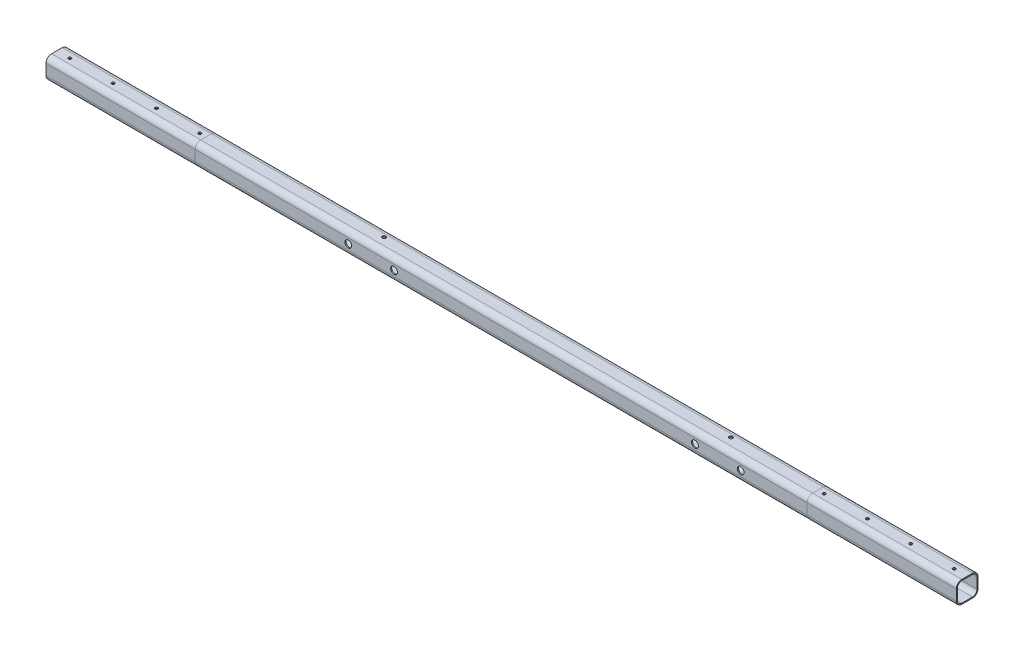
from build123d import *

# Parameters (mm, degrees)
MIEMBRO_ESTRUCTURAL1_DEPTH             = 1412
TALADRO_DE_MARGEN_PARA_M61_D           = 6.6
TALADRO_DE_MARGEN_PARA_M61_DEPTH       = 2.5
MIEMBRO_ESTRUCTURAL2_DEPTH             = 344.4
MIEMBRO_ESTRUCTURAL2_2_DEPTH           = 344.4
CROQUIS7_W                             = 3.3782
CROQUIS7_H                             = 2.5
TALADRO_DE_MARGEN_PARA_1_41_AT_2_COUNT = 2
TALADRO_DE_MARGEN_PARA_1_41_AT_2_PITCH = 45
TALADRO_DE_MARGEN_PARA_1_41_AT_3_COUNT = 2
TALADRO_DE_MARGEN_PARA_1_41_AT_3_PITCH = 90
TALADRO_START                          = 22.5
TALADRO_DE_MARGEN_PARA_1_42_OUTLINE_R  = 3.3782
TALADRO_DE_MARGEN_PARA_1_42_DEPTH      = 2.5
CUT_EXTRUDE1_REACH                     = 1136.143
SKETCH12_R                             = 7.9375
CUT_EXTRUDE2_REACH                     = 1136.143
SKETCH15_R                             = 4.1671875


# Read off the part's stored shape, not the designer's step: Taladro de margen para 1/42
with BuildPart() as part:
    # Sketch1 → Miembro estructural1 (new body)
    with BuildSketch(Plane.YZ.offset(-623.635182539)):
        with BuildLine():
            Line((-12.3, -25), (12.3, -25))
            ThreePointArc((12.3, -25), (21.280256121, -21.280256121), (25, -12.3))
            Line((25, -12.3), (25, 12.3))
            ThreePointArc((25, 12.3), (21.280256121, 21.280256121), (12.3, 25))
            Line((12.3, 25), (-12.3, 25))
            ThreePointArc((-12.3, 25), (-21.280256121, 21.280256121), (-25, 12.3))
            Line((-25, 12.3), (-25, -12.3))
            ThreePointArc((-25, -12.3), (-21.280256121, -21.280256121), (-12.3, -25))
        make_face()
        with BuildLine():
            Line((-12.3, -22.5), (12.3, -22.5))
            ThreePointArc((12.3, -22.5), (19.512489168, -19.512489168), (22.5, -12.3))
            Line((22.5, -12.3), (22.5, 12.3))
            ThreePointArc((22.5, 12.3), (19.512489168, 19.512489168), (12.3, 22.5))
            Line((12.3, 22.5), (-12.3, 22.5))
            ThreePointArc((-12.3, 22.5), (-19.512489168, 19.512489168), (-22.5, 12.3))
            Line((-22.5, 12.3), (-22.5, -12.3))
            ThreePointArc((-22.5, -12.3), (-19.512489168, -19.512489168), (-12.3, -22.5))
        make_face(mode=Mode.SUBTRACT)
    extrude(amount=MIEMBRO_ESTRUCTURAL1_DEPTH)

    # Taladro de margen para M61
    with Locations(Plane(origin=(0, -25, 0), x_dir=(-1, 0, 0), z_dir=(0, -1, 0))):
        with Locations((-152.364817461, 0), (-212.364817461, 0)):
            Hole(TALADRO_DE_MARGEN_PARA_M61_D / 2, depth=TALADRO_DE_MARGEN_PARA_M61_DEPTH)

    # Croquis7 → Taladro de margen para 1/41 (revolve, cut)
    with BuildSketch(Plane(origin=(137.364817461, -25, 0), x_dir=(0, 0, -1), z_dir=(1, 0, 0))):
        with Locations((1.6891, 1.25)):
            Rectangle(CROQUIS7_W, CROQUIS7_H)
    taladro_de_margen_para_1_41 = revolve(axis=Axis((137.364817461, -31.35, 0), (0, 1, 0)), mode=Mode.SUBTRACT)

    # Taladro de margen para 1/41 at 2: Taladro de margen para 1/41 ×2
    with Locations(*[(i * TALADRO_DE_MARGEN_PARA_1_41_AT_2_PITCH, 0, 0) for i in range(1, TALADRO_DE_MARGEN_PARA_1_41_AT_2_COUNT)]):
        add(taladro_de_margen_para_1_41, mode=Mode.SUBTRACT)

    # Taladro de margen para 1/41 at 3: Taladro de margen para 1/41 ×2
    with Locations(*[(i * TALADRO_DE_MARGEN_PARA_1_41_AT_3_PITCH, 0, 0) for i in range(1, TALADRO_DE_MARGEN_PARA_1_41_AT_3_COUNT)]):
        add(taladro_de_margen_para_1_41, mode=Mode.SUBTRACT)

    # Cut-Extrude1: up to this face of the body (flat: up to its plane)
    cut_extrude1_end = Plane(part.part.faces().sort_by_distance((82.364817461, 0, -25))[0])
    # Sketch12 → Cut-Extrude1 (cut, up to the picked face)
    with BuildSketch(Plane.XY.offset(25), mode=Mode.PRIVATE) as cut_extrude1_sk1:
        with Locations((-270.418972539, 0)):
            Circle(SKETCH12_R)
    cut_extrude1_tool1 = split(extrude(cut_extrude1_sk1.sketch, amount=-CUT_EXTRUDE1_REACH, mode=Mode.PRIVATE), bisect_by=cut_extrude1_end, keep=Keep.BOTH, mode=Mode.PRIVATE)
    # Sketch12 → Cut-Extrude1 (cut, up to the picked face)
    with BuildSketch(Plane.XY.offset(25), mode=Mode.PRIVATE) as cut_extrude1_sk2:
        with Locations((635.148607461, 0)):
            Circle(SKETCH12_R)
    cut_extrude1_tool2 = split(extrude(cut_extrude1_sk2.sketch, amount=-CUT_EXTRUDE1_REACH, mode=Mode.PRIVATE), bisect_by=cut_extrude1_end, keep=Keep.BOTH, mode=Mode.PRIVATE)
    # Sketch12 → Cut-Extrude1 (cut, up to the picked face)
    with BuildSketch(Plane.XY.offset(25), mode=Mode.PRIVATE) as cut_extrude1_sk3:
        with Locations((529.581027461, 0)):
            Circle(SKETCH12_R)
    cut_extrude1_tool3 = split(extrude(cut_extrude1_sk3.sketch, amount=-CUT_EXTRUDE1_REACH, mode=Mode.PRIVATE), bisect_by=cut_extrude1_end, keep=Keep.BOTH, mode=Mode.PRIVATE)
    # Sketch12 → Cut-Extrude1 (cut, up to the picked face)
    with BuildSketch(Plane.XY.offset(25), mode=Mode.PRIVATE) as cut_extrude1_sk4:
        with Locations((-164.851392539, 0)):
            Circle(SKETCH12_R)
    cut_extrude1_tool4 = split(extrude(cut_extrude1_sk4.sketch, amount=-CUT_EXTRUDE1_REACH, mode=Mode.PRIVATE), bisect_by=cut_extrude1_end, keep=Keep.BOTH, mode=Mode.PRIVATE)
    add(cut_extrude1_tool1.solids().sort_by(Axis((-270.418973, 0, 25), (0, 0, -1)))[0], mode=Mode.SUBTRACT)
    add(cut_extrude1_tool2.solids().sort_by(Axis((635.148607, 0, 25), (0, 0, -1)))[0], mode=Mode.SUBTRACT)
    add(cut_extrude1_tool3.solids().sort_by(Axis((529.581027, 0, 25), (0, 0, -1)))[0], mode=Mode.SUBTRACT)
    add(cut_extrude1_tool4.solids().sort_by(Axis((-164.851393, 0, 25), (0, 0, -1)))[0], mode=Mode.SUBTRACT)

    # Cut-Extrude2: up to this face of the body (flat: up to its plane)
    cut_extrude2_end = Plane(part.part.faces().sort_by_distance((81.85559972, -25, 0))[0])
    # Sketch15 → Cut-Extrude2 (cut, up to the picked face)
    with BuildSketch(Plane(origin=(0, 25, 0), x_dir=(-1, 0, 0), z_dir=(0, 1, 0)), mode=Mode.PRIVATE) as cut_extrude2_sk1:
        with Locations(Location((-582.364817461, -5, 0), (0, 0, 90))):
            Circle(SKETCH15_R)
    cut_extrude2_tool1 = split(extrude(cut_extrude2_sk1.sketch, amount=-CUT_EXTRUDE2_REACH, mode=Mode.PRIVATE), bisect_by=cut_extrude2_end, keep=Keep.BOTH, mode=Mode.PRIVATE)
    # Sketch15 → Cut-Extrude2 (cut, up to the picked face)
    with BuildSketch(Plane(origin=(0, 25, 0), x_dir=(-1, 0, 0), z_dir=(0, 1, 0)), mode=Mode.PRIVATE) as cut_extrude2_sk2:
        with Locations((217.635182539, -5)):
            Circle(SKETCH15_R)
    cut_extrude2_tool2 = split(extrude(cut_extrude2_sk2.sketch, amount=-CUT_EXTRUDE2_REACH, mode=Mode.PRIVATE), bisect_by=cut_extrude2_end, keep=Keep.BOTH, mode=Mode.PRIVATE)
    add(cut_extrude2_tool1.solids().sort_by(Axis((582.364817, 25, -5), (0, -1, 0)))[0], mode=Mode.SUBTRACT)
    add(cut_extrude2_tool2.solids().sort_by(Axis((-217.635183, 25, -5), (0, -1, 0)))[0], mode=Mode.SUBTRACT)


with BuildPart() as body_2:
    # Sketch11 → Miembro estructural2 (new body)
    with BuildSketch(Plane(origin=(-623.635182539, 0, 0), x_dir=(0, -1, 0), z_dir=(-1, 0, 0))):
        with BuildLine():
            Line((-12.3, -25), (12.3, -25))
            ThreePointArc((12.3, -25), (21.280256121, -21.280256121), (25, -12.3))
            Line((25, -12.3), (25, 12.3))
            ThreePointArc((25, 12.3), (21.280256121, 21.280256121), (12.3, 25))
            Line((12.3, 25), (-12.3, 25))
            ThreePointArc((-12.3, 25), (-21.280256121, 21.280256121), (-25, 12.3))
            Line((-25, 12.3), (-25, -12.3))
            ThreePointArc((-25, -12.3), (-21.280256121, -21.280256121), (-12.3, -25))
        make_face()
        with BuildLine():
            Line((-12.3, -22.5), (12.3, -22.5))
            ThreePointArc((12.3, -22.5), (19.512489168, -19.512489168), (22.5, -12.3))
            Line((22.5, -12.3), (22.5, 12.3))
            ThreePointArc((22.5, 12.3), (19.512489168, 19.512489168), (12.3, 22.5))
            Line((12.3, 22.5), (-12.3, 22.5))
            ThreePointArc((-12.3, 22.5), (-19.512489168, 19.512489168), (-22.5, 12.3))
            Line((-22.5, 12.3), (-22.5, -12.3))
            ThreePointArc((-22.5, -12.3), (-19.512489168, -19.512489168), (-12.3, -22.5))
        make_face(mode=Mode.SUBTRACT)
    extrude(amount=MIEMBRO_ESTRUCTURAL2_DEPTH)


with BuildPart() as body_3:
    # Sketch11 on segment 2 (carried to segment 2) → Miembro estructural2 2 (new body)
    with BuildSketch(Plane(origin=(1132.764817461, 0, 0), x_dir=(0, -1, 0), z_dir=(-1, 0, 0))):
        with BuildLine():
            Line((-12.3, -25), (12.3, -25))
            ThreePointArc((12.3, -25), (21.280256121, -21.280256121), (25, -12.3))
            Line((25, -12.3), (25, 12.3))
            ThreePointArc((25, 12.3), (21.280256121, 21.280256121), (12.3, 25))
            Line((12.3, 25), (-12.3, 25))
            ThreePointArc((-12.3, 25), (-21.280256121, 21.280256121), (-25, 12.3))
            Line((-25, 12.3), (-25, -12.3))
            ThreePointArc((-25, -12.3), (-21.280256121, -21.280256121), (-12.3, -25))
        make_face()
        with BuildLine():
            Line((-12.3, -22.5), (12.3, -22.5))
            ThreePointArc((12.3, -22.5), (19.512489168, -19.512489168), (22.5, -12.3))
            Line((22.5, -12.3), (22.5, 12.3))
            ThreePointArc((22.5, 12.3), (19.512489168, 19.512489168), (12.3, 22.5))
            Line((12.3, 22.5), (-12.3, 22.5))
            ThreePointArc((-12.3, 22.5), (-19.512489168, 19.512489168), (-22.5, 12.3))
            Line((-22.5, 12.3), (-22.5, -12.3))
            ThreePointArc((-22.5, -12.3), (-19.512489168, -19.512489168), (-12.3, -22.5))
        make_face(mode=Mode.SUBTRACT)
    extrude(amount=MIEMBRO_ESTRUCTURAL2_2_DEPTH)


with BuildPart() as taladro_de_margen_para_1_42_tool:
    # Taladro de margen para 1/42 outline → Taladro de margen para 1/42 (new body)
    with BuildSketch(Plane(origin=(0, 0, 0), x_dir=(1, 0, 0), z_dir=(0, 1, 0)).offset(TALADRO_START)):
        with Locations((1102.764817461, 0)):
            Circle(TALADRO_DE_MARGEN_PARA_1_42_OUTLINE_R)
        with Locations((1002.764817461, 0)):
            Circle(TALADRO_DE_MARGEN_PARA_1_42_OUTLINE_R)
        with Locations((902.764817461, 0)):
            Circle(TALADRO_DE_MARGEN_PARA_1_42_OUTLINE_R)
        with Locations((802.764817461, 0)):
            Circle(TALADRO_DE_MARGEN_PARA_1_42_OUTLINE_R)
        with Locations((-638.035182539, 0)):
            Circle(TALADRO_DE_MARGEN_PARA_1_42_OUTLINE_R)
        with Locations((-738.035182539, 0)):
            Circle(TALADRO_DE_MARGEN_PARA_1_42_OUTLINE_R)
        with Locations((-838.035182539, 0)):
            Circle(TALADRO_DE_MARGEN_PARA_1_42_OUTLINE_R)
        with Locations((-938.035182539, 0)):
            Circle(TALADRO_DE_MARGEN_PARA_1_42_OUTLINE_R)
    extrude(amount=TALADRO_DE_MARGEN_PARA_1_42_DEPTH)


with BuildPart() as body_2_1:
    add(body_2.part)

    # Taladro de margen para 1/42: cut by taladro_de_margen_para_1_42_tool
    add(taladro_de_margen_para_1_42_tool.part, mode=Mode.SUBTRACT)


with BuildPart() as body_3_1:
    add(body_3.part)

    # Taladro de margen para 1/42: cut by taladro_de_margen_para_1_42_tool
    add(taladro_de_margen_para_1_42_tool.part, mode=Mode.SUBTRACT)


solid = Compound([part.part, body_2_1.part, body_3_1.part])
